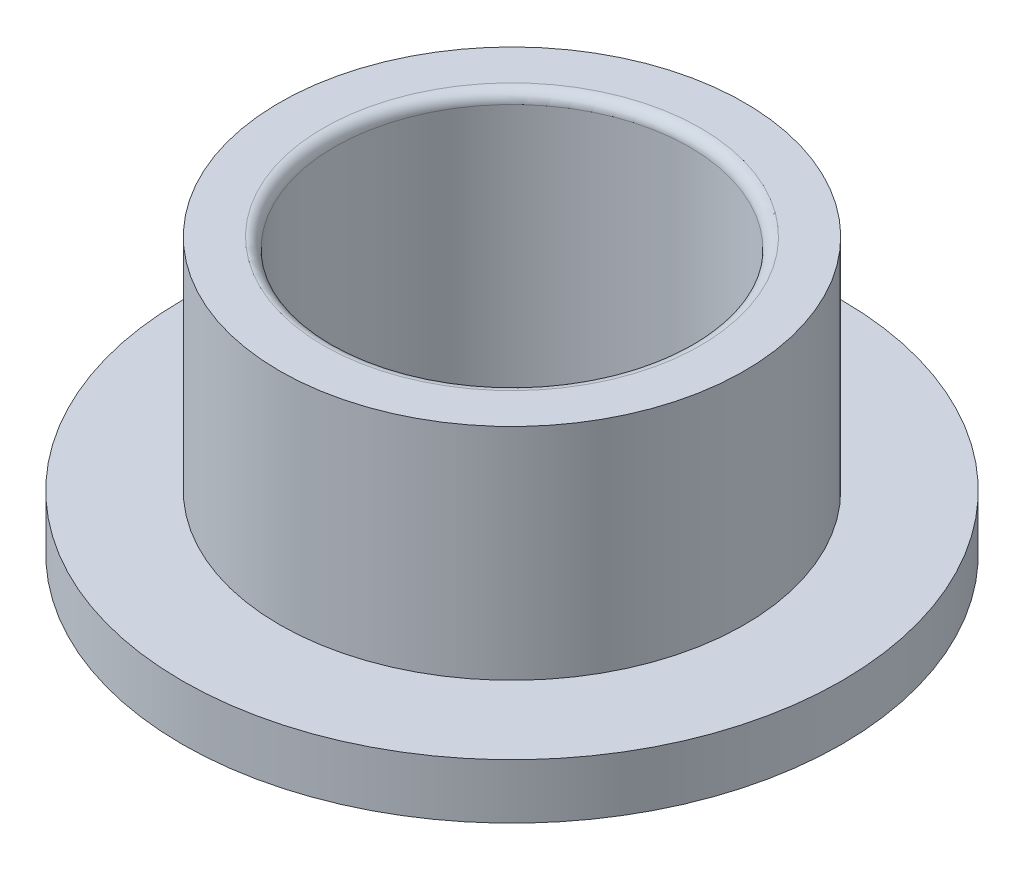
from build123d import *

# Parameters (mm, degrees)
SKETCH1_R           = 21.15
SKETCH1_R_2         = 16.15
BOSS_EXTRUDE1_DEPTH = 20
FILLET1_R           = 1
BOSS_EXTRUDE2_START = 5
SKETCH2_R           = 30
SKETCH2_R_2         = 16.15
BOSS_EXTRUDE2_DEPTH = 5
FILLET2_R           = 1


with BuildPart() as part:
    # Sketch1 → Boss-Extrude1 (new body)
    with BuildSketch(Plane(origin=(0, 0, 0), x_dir=(1, 0, 0), z_dir=(0, 1, 0))):
        Circle(SKETCH1_R)
        Circle(SKETCH1_R_2, mode=Mode.SUBTRACT)
    extrude(amount=BOSS_EXTRUDE1_DEPTH)

    # Fillet1
    fillet1_edges = [part.edges().sort_by_distance(p)[0] for p in [
        (-16.15, 20, 0),
    ]]
    fillet(fillet1_edges, radius=FILLET1_R)

    # Sketch2 → Boss-Extrude2 (add)
    with BuildSketch(Plane.XZ.offset(BOSS_EXTRUDE2_START)):
        Circle(SKETCH2_R)
        Circle(SKETCH2_R_2, mode=Mode.SUBTRACT)
    extrude(amount=-BOSS_EXTRUDE2_DEPTH)

    # Fillet2
    fillet2_edges = [part.edges().sort_by_distance(p)[0] for p in [
        (-16.15, -5, 0),
    ]]
    fillet(fillet2_edges, radius=FILLET2_R)


solid = part.part
